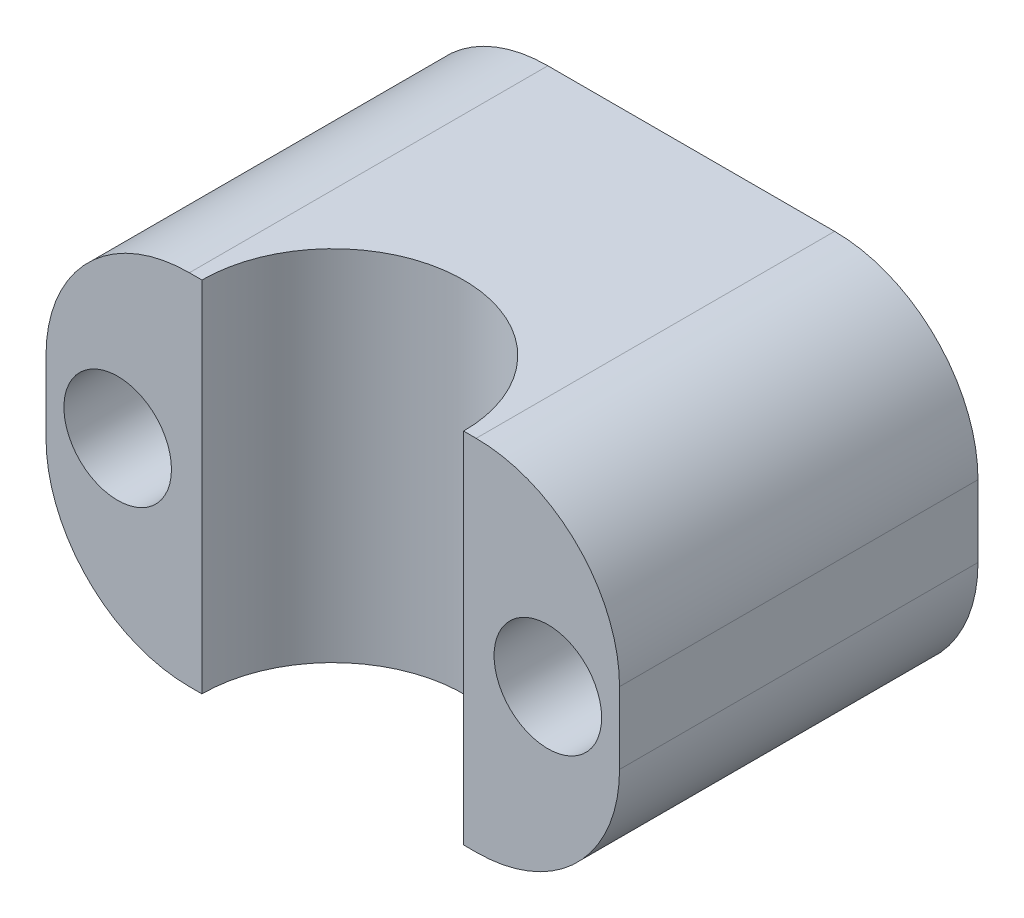
from build123d import *

# Parameters (mm, degrees)
EXTRUDE_1_DEPTH     = 10
CUT_EXTRUDE_1_REACH = 18.248
SKETCH_2_R          = 3.65
CUT_EXTRUDE_2_REACH = 15.748
SKETCH_3_R          = 1.5


with BuildPart() as part:
    # Эскиз1 → Бобышка-Вытянуть1 (new body)
    with BuildSketch(Plane.XY):
        with BuildLine():
            Line((-4, 5), (4, 5))
            ThreePointArc((4, 5), (6.828427125, 3.828427125), (8, 1))
            Line((8, 1), (8, -1))
            ThreePointArc((8, -1), (6.828427125, -3.828427125), (4, -5))
            Line((4, -5), (-4, -5))
            ThreePointArc((-4, -5), (-6.828427125, -3.828427125), (-8, -1))
            Line((-8, -1), (-8, 1))
            ThreePointArc((-8, 1), (-6.828427125, 3.828427125), (-4, 5))
        make_face()
    extrude(amount=EXTRUDE_1_DEPTH)

    # Эскиз2 → Вырез-Вытянуть1 (cut, up to next)
    with BuildSketch(Plane(origin=(0, 5, 0), x_dir=(1, 0, 0), z_dir=(0, 1, 0)), mode=Mode.PRIVATE) as cut_extrude_1_sk1:
        with Locations((0, -10)):
            Circle(SKETCH_2_R)
    cut_extrude_1_tool1 = extrude(cut_extrude_1_sk1.sketch, amount=-CUT_EXTRUDE_1_REACH, mode=Mode.PRIVATE) & part.part
    add(cut_extrude_1_tool1.solids().sort_by_distance((0, 5, 10))[0], mode=Mode.SUBTRACT)

    # Эскиз3 → Вырез-Вытянуть2 (cut, up to next)
    with BuildSketch(Plane.XY.offset(10), mode=Mode.PRIVATE) as cut_extrude_2_sk1:
        with Locations((-6, 0)):
            Circle(SKETCH_3_R)
    cut_extrude_2_tool1 = extrude(cut_extrude_2_sk1.sketch, amount=-CUT_EXTRUDE_2_REACH, mode=Mode.PRIVATE) & part.part
    # Эскиз3 → Вырез-Вытянуть2 (cut, up to next)
    with BuildSketch(Plane.XY.offset(10), mode=Mode.PRIVATE) as cut_extrude_2_sk2:
        with Locations((6, 0)):
            Circle(SKETCH_3_R)
    cut_extrude_2_tool2 = extrude(cut_extrude_2_sk2.sketch, amount=-CUT_EXTRUDE_2_REACH, mode=Mode.PRIVATE) & part.part
    add(cut_extrude_2_tool1.solids().sort_by_distance((-6, 0, 10))[0], mode=Mode.SUBTRACT)
    add(cut_extrude_2_tool2.solids().sort_by_distance((6, 0, 10))[0], mode=Mode.SUBTRACT)


solid = part.part
